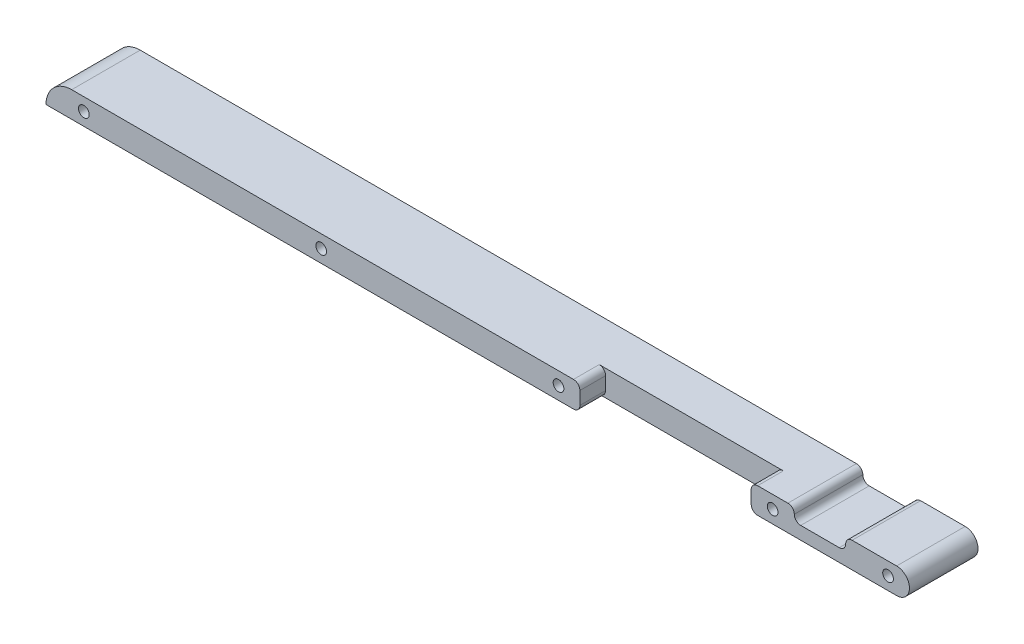
from build123d import *

# Parameters (mm, degrees)
EXTRUDE_854_DEPTH      = 8
SKETCH_2_W             = 20
SKETCH_2_H             = 3
CUT_EXTRUDE_1137_DEPTH = 3
HOLE_WIZARD_1_6_D      = 1.25
SKETCH_7_W             = 6
SKETCH_7_H             = 1.5
CUT_EXTRUDE_2764_DEPTH = 102.181383663
FILLET_2_RADIUS        = 1.5
FILLET_2_LENGTH        = 8
FILLET_3_R             = 0.75


with BuildPart() as part:
    # Model → Extrude 854 (new body)
    with BuildSketch(Plane.XY):
        with BuildLine():
            Line((100.82, 3), (3, 3))
            ThreePointArc((3, 3), (0.878679656, 2.121320344), (0, 0))
            Line((0, 0), (100.82, 0))
            Line((100.82, 0), (100.82, 3))
        make_face()
    extrude(amount=EXTRUDE_854_DEPTH)

    # Эскиз2 → Cut-Extrude 1137 (cut)
    with BuildSketch(Plane.XY.offset(8)):
        with Locations((72.34, 1.5)):
            Rectangle(SKETCH_2_W, SKETCH_2_H)
    extrude(amount=-CUT_EXTRUDE_1137_DEPTH, mode=Mode.SUBTRACT)

    # Резьба М1.6 (through all)
    with Locations(Plane.XY.offset(8)):
        with Locations((4.42, 1.5), (59.84, 1.5), (84.84, 1.5), (98.32, 1.5), (32.13, 1.5)):
            Hole(HOLE_WIZARD_1_6_D / 2)

    # Эскиз7 → Cut-Extrude 2764 (cut, through all)
    with BuildSketch(Plane.XY.offset(8)):
        with Locations((90.37, 2.25)):
            Rectangle(SKETCH_7_W, SKETCH_7_H)
    extrude(amount=-CUT_EXTRUDE_2764_DEPTH, mode=Mode.SUBTRACT)

    # Скругление2: full round fillet: the end face becomes a half cylinder, R = half its width
    fillet_2_face = Plane((100.82, 1.5, 4), x_dir=(0, 0, 1), z_dir=(1, 0, 0))  # on the end face: x along it, z out of the body
    fillet_2_slab = fillet_2_face.offset(-FILLET_2_RADIUS / 2) * Box(FILLET_2_LENGTH, 2 * FILLET_2_RADIUS, FILLET_2_RADIUS, mode=Mode.PRIVATE)  # the body's end, R deep
    fillet_2_round = Plane((99.32, 1.5, 4), x_dir=(1, 0, 0), z_dir=(0, 0, 1)) * Cylinder(FILLET_2_RADIUS, FILLET_2_LENGTH, mode=Mode.PRIVATE)  # its axis R under the face
    add(fillet_2_slab - fillet_2_round, mode=Mode.SUBTRACT)

    # Скругление3
    fillet_3_edges = [part.edges().sort_by_distance(p)[0] for p in [
        (62.34, 0, 6.5),
        (82.34, 0, 6.5),
        (93.37, 1.5, 4),
        (93.37, 3, 4),
        (87.37, 1.5, 4),
        (87.37, 3, 4),
        (82.34, 3, 6.5),
        (62.34, 3, 6.5),
    ]]
    fillet(fillet_3_edges, radius=FILLET_3_R - 0.0001)  # a hair under: the kernel refuses the full size


solid = part.part
